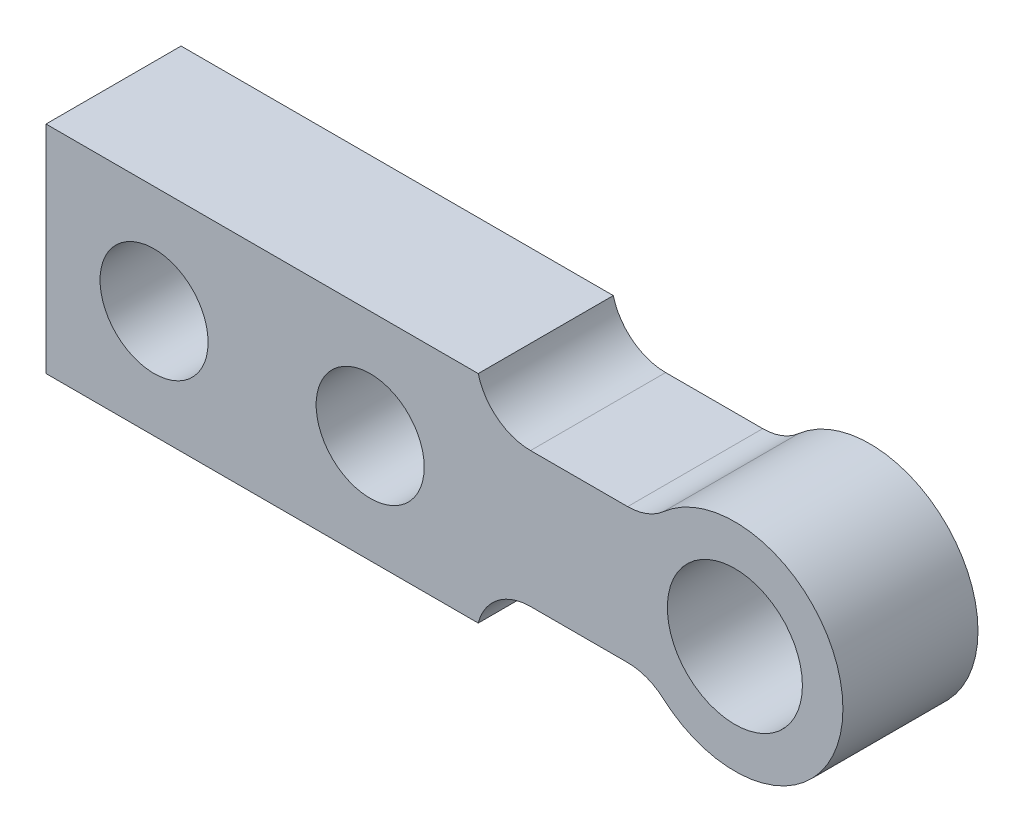
from build123d import *

# Parameters (mm, degrees)
SKETCH1_R           = 2
BOSS_EXTRUDE1_DEPTH = 5
FILLET1_R           = 2


with BuildPart() as part:
    # Sketch1 → Boss-Extrude1 (new body)
    with BuildSketch(Plane.XY):
        with BuildLine():
            Line((8, 4), (-8, 4))
            Line((-8, 4), (-8, -4))
            Line((-8, -4), (8, -4))
            Line((8, -4), (8, -2.5))
            Line((8, -2.5), (14.377501001, -2.5))
            ThreePointArc((14.377501001, -2.5), (21.5, 0), (14.377501001, 2.5))
            Line((14.377501001, 2.5), (8, 2.5))
            Line((8, 2.5), (8, 4))
        make_face()
        with Locations((-4, 0)):
            Circle(SKETCH1_R, mode=Mode.SUBTRACT)
        with Locations((4, 0)):
            Circle(SKETCH1_R, mode=Mode.SUBTRACT)
        with BuildLine():
            ThreePointArc((20, 0), (17.5, -2.5), (15, 0))
            ThreePointArc((15, 0), (17.5, 2.5), (20, 0))
        make_face(mode=Mode.SUBTRACT)
    extrude(amount=BOSS_EXTRUDE1_DEPTH)

    # Fillet1
    # the kernel refuses this fillet: 2 mm, written as the material it adds along each edge
    with BuildSketch(Plane(origin=(14.377501001, -2.5, 0), x_dir=(0.6900779887780536, -0.7237350132500407, 0), z_dir=(0, 0, 1))) as fillet1_piece_1:
        with BuildLine():
            CenterArc((0.863575741, -1.992528413), FILLET1_R, 94.954095219, 41.409622109)
            Line((-0.583894286, -0.612372436), (-0.612843687, -0.584769316))
            Line((-0.612843687, -0.584769316), (-0.028949401, 0.02760312))
            Line((-0.028949401, 0.02760312), (0.003454303, 0.039850568))
            ThreePointArc((0.003454303, 0.039850568), (0.345430296, 0.025056827), (0.687406289, 0.039850568))
            Line((0.687406289, 0.039850568), (0.690860592, 0))
        make_face()
    extrude(amount=5)
    with BuildSketch(Plane(origin=(8, -2.5, 0), x_dir=(1, 0, 0), z_dir=(0, 0, 1))) as fillet1_piece_2:
        with BuildLine():
            CenterArc((1.936491673, -2), FILLET1_R, 90, 75.522487814)
            Line((0, -1.5), (-0.038729833, -1.49))
            ThreePointArc((-0.038729833, -1.49), (-0.04, -0.75), (-0.04, 0))
            Line((-0.04, 0), (0, 0.04))
            Line((0, 0.04), (1.936491673, 0.04))
            Line((1.936491673, 0.04), (1.936491673, 0))
        make_face()
    extrude(amount=5)
    with BuildSketch(Plane(origin=(14.377501001, 2.5, 0), x_dir=(0.6900779887780526, 0.7237350132500416, 0), z_dir=(0, 0, 1))) as fillet1_piece_3:
        with BuildLine():
            CenterArc((0.863575741, 1.992528413), FILLET1_R, 223.636282672, 41.409622109)
            Line((-0.583894286, 0.612372436), (-0.612843687, 0.584769316))
            Line((-0.612843687, 0.584769316), (-0.028949401, -0.02760312))
            Line((-0.028949401, -0.02760312), (0.003454303, -0.039850568))
            ThreePointArc((0.003454303, -0.039850568), (0.345430296, -0.025056827), (0.687406289, -0.039850568))
            Line((0.687406289, -0.039850568), (0.690860592, 0))
        make_face()
    extrude(amount=5)
    with BuildSketch(Plane(origin=(8, 2.5, 0), x_dir=(0, 1, 0), z_dir=(0, 0, 1))) as fillet1_piece_4:
        with BuildLine():
            CenterArc((2, -1.936491673), FILLET1_R, 104.477512186, 75.522487814)
            Line((0, -1.936491673), (-0.04, -1.936491673))
            Line((-0.04, -1.936491673), (-0.04, 0))
            Line((-0.04, 0), (0, 0.04))
            ThreePointArc((0, 0.04), (0.75, 0.04), (1.49, 0.038729833))
            Line((1.49, 0.038729833), (1.5, 0))
        make_face()
    extrude(amount=5)


solid = part.part
